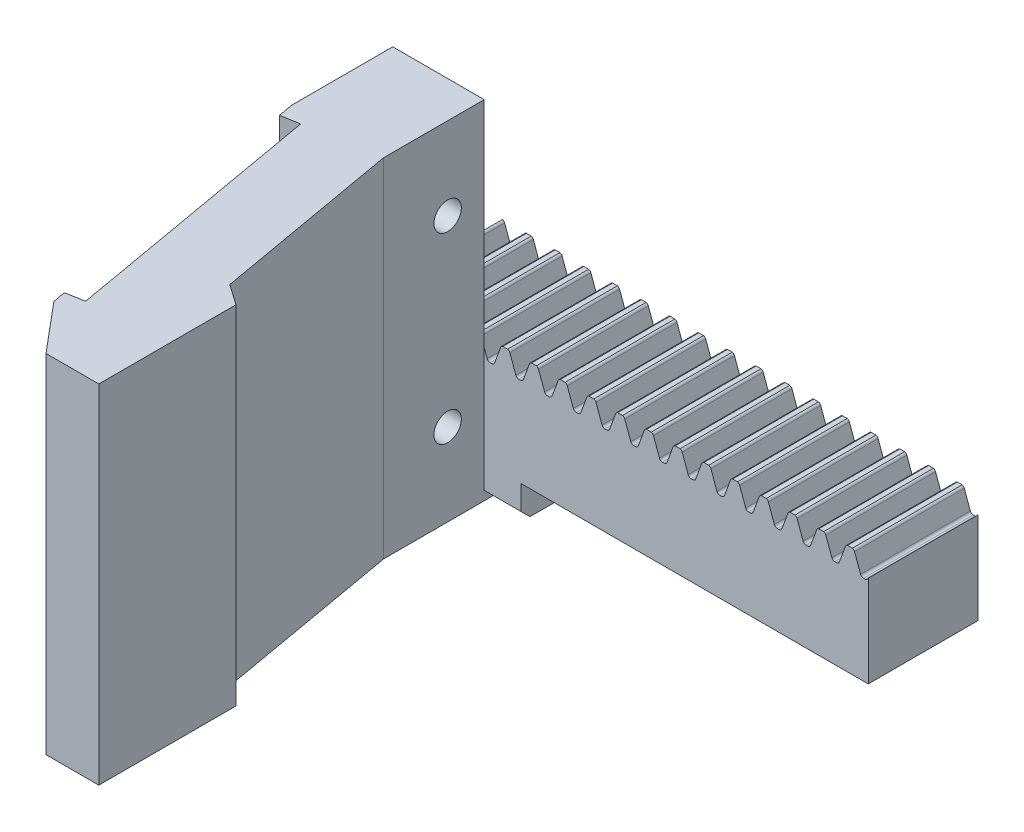
from build123d import *

# Parameters (mm, degrees)
BOSS_EXTRUDE1_DEPTH      = 6
BOSS_EXTRUDE1_DEPTH_BACK = 6
SKETCH3_W                = 100
SKETCH3_H                = 12
CUT_EXTRUDE1_DEPTH       = 51.714889332
LPATTERN1_COUNT          = 32
LPATTERN1_PITCH          = 3.141592654
LPATTERN1_COUNT_DIR2     = 2
LPATTERN1_PITCH_DIR2     = 3.141592654
SKETCH5_W                = 48.378939127
SKETCH5_H                = 12.380230967
CUT_EXTRUDE2_DEPTH       = 52.768716422
SKETCH6_W                = 10
SKETCH6_H                = 60
BOSS_EXTRUDE2_DEPTH      = 8
SKETCH8_R                = 1.5
CUT_EXTRUDE3_DEPTH       = 74.716454066
SKETCH9_W                = 11.14
SKETCH9_H                = 60
BOSS_EXTRUDE3_DEPTH      = 40
CUT_EXTRUDE4_DEPTH       = 95.952619764
CUT_EXTRUDE4_DEPTH_BACK  = 95.952619764
SKETCH10_W               = 1.14
SKETCH10_H               = 30
CHAMFER1_SIZE            = 12
SKETCH11_OUTSIDE_W       = 81.904
SKETCH11_OUTSIDE_H       = 81.904
SKETCH11_OUTSIDE_R       = 1.5
CUT_EXTRUDE7_DEPTH       = 71
CUT_EXTRUDE8_DEPTH       = 30
CUT_EXTRUDE8_DEPTH_BACK  = 30
BOSS_EXTRUDE4_DEPTH      = 60
SKETCH14_W               = 29
SKETCH14_H               = 57
CUT_EXTRUDE9_DEPTH       = 2
CHAMFER2_SIZE            = 4
SKETCH17_W               = 4
SKETCH17_H               = 12
BOSS_EXTRUDE5_DEPTH      = 3.66
SKETCH20_W               = 10
SKETCH20_H               = 3.66
BOSS_EXTRUDE6_DEPTH      = 5.66
CHAMFER8_SIZE            = 1
SKETCH21_R               = 2.5
CUT_EXTRUDE10_DEPTH      = 10
SKETCH22_R               = 3.95
CUT_EXTRUDE11_DEPTH      = 8
CUT_EXTRUDE13_DEPTH      = 10
CUT_EXTRUDE13_DEPTH_BACK = 10
SKETCH25_W               = 11
SKETCH25_H               = 22


with BuildPart() as part:
    # Sketch3 → Boss-Extrude1 (new, two sides: drawn at the far end of the back side and taken through both)
    with BuildSketch(Plane.XY.offset(-BOSS_EXTRUDE1_DEPTH_BACK)):
        Rectangle(SKETCH3_W, SKETCH3_H)
    extrude(amount=BOSS_EXTRUDE1_DEPTH + BOSS_EXTRUDE1_DEPTH_BACK)

    # Sketch4 → Cut-Extrude1 (cut, symmetric)
    with BuildSketch(Plane.XY):
        with BuildLine():
            Line((-47.625666184, 5.779244445), (-47.545317733, 6))
            Line((-47.545317733, 6), (-48.694686131, 6))
            Line((-48.694686131, 6), (-48.694686131, 3.75))
            Line((-48.694686131, 3.75), (-48.599173915, 3.75))
            ThreePointArc((-48.599173915, 3.75), (-48.406736132, 3.8106754), (-48.283902309, 3.970755555))
            Line((-48.283902309, 3.970755555), (-47.625666184, 5.779244445))
        make_face()
        with BuildLine():
            Line((-47.310394578, 6), (-47.545317733, 6))
            Line((-47.545317733, 6), (-47.625666184, 5.779244445))
            ThreePointArc((-47.625666184, 5.779244445), (-47.502832361, 5.9393246), (-47.310394578, 6))
        make_face()
        with BuildLine():
            Line((-46.622113424, 5.779244445), (-46.702461875, 6))
            Line((-46.702461875, 6), (-46.93738503, 6))
            ThreePointArc((-46.93738503, 6), (-46.744947247, 5.9393246), (-46.622113424, 5.779244445))
        make_face()
        with BuildLine():
            Line((-45.553093477, 3.75), (-45.553093477, 6))
            Line((-45.553093477, 6), (-46.702461875, 6))
            Line((-46.702461875, 6), (-46.622113424, 5.779244445))
            Line((-46.622113424, 5.779244445), (-45.963877299, 3.970755555))
            ThreePointArc((-45.963877299, 3.970755555), (-45.841043475, 3.8106754), (-45.648605692, 3.75))
            Line((-45.648605692, 3.75), (-45.553093477, 3.75))
        make_face()
    cut_extrude1 = extrude(amount=CUT_EXTRUDE1_DEPTH, both=True, mode=Mode.SUBTRACT)

    # LPattern1: Cut-Extrude1 32 × 2
    with Locations(*[Vector(1, 0, 0) * (i * LPATTERN1_PITCH) + Vector(-1, 0, 0) * (j * LPATTERN1_PITCH_DIR2) for i in range(LPATTERN1_COUNT) for j in range(LPATTERN1_COUNT_DIR2) if (i, j) != (0, 0)]):
        add(cut_extrude1, mode=Mode.SUBTRACT)

    # Sketch5 → Cut-Extrude2 (cut, through all)
    with BuildSketch(Plane.XY.offset(6)):
        with Locations((26.189469564, 0.190115484)):
            Rectangle(SKETCH5_W, SKETCH5_H)
    extrude(amount=-CUT_EXTRUDE2_DEPTH, mode=Mode.SUBTRACT)

    # Sketch6 → Boss-Extrude2 (add)
    with BuildSketch(Plane.XY.offset(6)):
        with Locations((-45, 20.34)):
            Rectangle(SKETCH6_W, SKETCH6_H)
    extrude(amount=BOSS_EXTRUDE2_DEPTH)

    # Sketch8 → Cut-Extrude3 (cut, through all)
    with BuildSketch(Plane.ZY.offset(50)):
        with Locations((10, 19.34)):
            Circle(SKETCH8_R)
        with Locations((10, -0.66)):
            Circle(SKETCH8_R)
    extrude(amount=-CUT_EXTRUDE3_DEPTH, mode=Mode.SUBTRACT)

    # Sketch9 → Boss-Extrude3 (add)
    with BuildSketch(Plane.XY.offset(14)):
        with Locations((-44.43, 20.34)):
            Rectangle(SKETCH9_W, SKETCH9_H)
    extrude(amount=BOSS_EXTRUDE3_DEPTH)

    # Sketch10 → Cut-Extrude4 (cut, two sides: drawn at the far end of the back side and taken through both)
    with BuildSketch(Plane.XZ.offset(9.66).offset(-CUT_EXTRUDE4_DEPTH_BACK)):
        with Locations((-39.43, 29)):
            Rectangle(SKETCH10_W, SKETCH10_H)
    extrude(amount=CUT_EXTRUDE4_DEPTH + CUT_EXTRUDE4_DEPTH_BACK, mode=Mode.SUBTRACT)

    # Chamfer1
    # the kernel refuses this chamfer: 12 mm, written as the material it adds along each edge
    with BuildSketch(Plane(origin=(-40, -6, 6), x_dir=(0, -0.9996219169112968, 0.027495876610586334), z_dir=(-1, 0, 0))) as chamfer1_piece_1_section:
        Polygon((CHAMFER1_SIZE * 0.999621916911, -CHAMFER1_SIZE * 0.0274958766106), (-CHAMFER1_SIZE * 0.0274958766106, -CHAMFER1_SIZE * 0.999621916911), (0, 0), align=None)
    chamfer1_piece_1 = extrude(amount=10, mode=Mode.PRIVATE)
    chamfer1_piece_1 = split(chamfer1_piece_1, bisect_by=Plane(origin=(-45, -9.66, 0.860117994), z_dir=(0, 1, 0)), keep=Keep.TOP, mode=Mode.PRIVATE)
    add(chamfer1_piece_1)

    # Sketch11 outside → Cut-Extrude7 (cut)
    # profile 1 of 3: a face of its own
    with BuildSketch(Plane.ZY.offset(50)):
        with Locations((24, 20.34)):
            Rectangle(SKETCH11_OUTSIDE_W, SKETCH11_OUTSIDE_H)
        Polygon((-6, -6), (-2.34, -9.66), (43.472559651, -9.66), (48.343145751, -9.66), (54, -4.003145751), (54, 44.683145751), (48.343145751, 50.34), (6, 50.34), (6, 5.990571879), (-6, 5.990571879), align=None, mode=Mode.SUBTRACT)
    # profile 2 of 3: a face of its own
    with BuildSketch(Plane.ZY.offset(50)):
        with Locations((10, -0.66)):
            Circle(SKETCH11_OUTSIDE_R)
    # profile 3 of 3: a face of its own
    with BuildSketch(Plane.ZY.offset(50)):
        with Locations((10, 19.34)):
            Circle(SKETCH11_OUTSIDE_R)
    extrude(amount=-CUT_EXTRUDE7_DEPTH, mode=Mode.SUBTRACT)

    # Sketch12 → Cut-Extrude8 (cut, two sides: drawn at the far end of the back side and taken through both)
    with BuildSketch(Plane(origin=(-40, 0, 0), x_dir=(0, 0, -1), z_dir=(1, 0, 0)).offset(-CUT_EXTRUDE8_DEPTH_BACK)):
        Polygon((-54, 44.683145751), (-54, -9.66), (-17, -9.66), (-17, 50.34), (-54, 50.34), align=None)
    extrude(amount=CUT_EXTRUDE8_DEPTH + CUT_EXTRUDE8_DEPTH_BACK, mode=Mode.SUBTRACT)

    # Sketch13 → Boss-Extrude4 (add)
    with BuildSketch(Plane.XZ.offset(9.66)):
        Polygon((-40, 17), (-36.39873348, 37.42379734), (-34.147682793, 39), (-34.147682793, 54), (-39.921908572, 54), (-44.42142184, 48.637688898), (-50, 17), align=None)
    extrude(amount=-BOSS_EXTRUDE4_DEPTH)

    # Sketch14 → Cut-Extrude9 (cut)
    with BuildSketch(Plane(origin=(-51.399486738, 0, 9.063116306), x_dir=(0.17364817766692728, 0, 0.9848077530122086), z_dir=(-0.9848077530122086, 0, 0.17364817766692728))):
        with Locations((24.270860601, 20.254213562)):
            Rectangle(SKETCH14_W, SKETCH14_H)
    extrude(amount=-CUT_EXTRUDE9_DEPTH, mode=Mode.SUBTRACT)

    # Chamfer2
    chamfer2_edges = [part.edges().sort_by_distance(p)[0] for p in [
        (-48.717986847, -8.245786438, 18.511887403),
        (-48.717986847, 48.754213562, 18.511887403),
        (-43.682189695, 48.754213562, 47.07131224),
        (-43.682189695, -8.245786438, 47.07131224),
    ]]
    chamfer(chamfer2_edges, length=CHAMFER2_SIZE)

    # Sketch17 → Boss-Extrude5 (add)
    with BuildSketch(Plane.XZ.offset(6)):
        with Locations((-38, 0)):
            Rectangle(SKETCH17_W, SKETCH17_H)
    extrude(amount=BOSS_EXTRUDE5_DEPTH)

    # Sketch20 → Boss-Extrude6 (add)
    with BuildSketch(Plane.XZ.offset(9.66)):
        with Locations((-45, -4.17)):
            Rectangle(SKETCH20_W, SKETCH20_H)
    extrude(amount=-BOSS_EXTRUDE6_DEPTH)

    # Chamfer8
    chamfer8_edges = [part.edges().sort_by_distance(p)[0] for p in [
        (-38, -9.66, 6),
    ]]
    chamfer(chamfer8_edges, length=CHAMFER8_SIZE)

    # Sketch21 → Cut-Extrude10 (cut)
    with BuildSketch(Plane.XZ.offset(9.66)):
        with Locations(Location((-43, -0.5, 0), (0, 0, 270))):
            Circle(SKETCH21_R)
    extrude(amount=-CUT_EXTRUDE10_DEPTH, mode=Mode.SUBTRACT)

    # Sketch22 → Cut-Extrude11 (cut)
    with BuildSketch(Plane.XZ.offset(9.66)):
        with Locations(Location((-43, -0.5, 0), (0, 0, 270))):
            Circle(SKETCH22_R)
    extrude(amount=-CUT_EXTRUDE11_DEPTH, mode=Mode.SUBTRACT)

    # Sketch25 → Cut-Extrude13 (cut, two sides: drawn at the far end of the back side and taken through both)
    with BuildSketch(Plane(origin=(-40, 0, 0), x_dir=(0, 0, -1), z_dir=(1, 0, 0)).offset(-CUT_EXTRUDE13_DEPTH_BACK)):
        Polygon((-71.113841481, 28.34), (-17, 28.34), (-17, 50.34), (-6, 50.34), (-6, 51.96435935), (-71.113841481, 51.96435935), align=None)
        with Locations((-11.5, 39.34)):
            Rectangle(SKETCH25_W, SKETCH25_H)
    extrude(amount=CUT_EXTRUDE13_DEPTH + CUT_EXTRUDE13_DEPTH_BACK, mode=Mode.SUBTRACT)


solid = part.part
